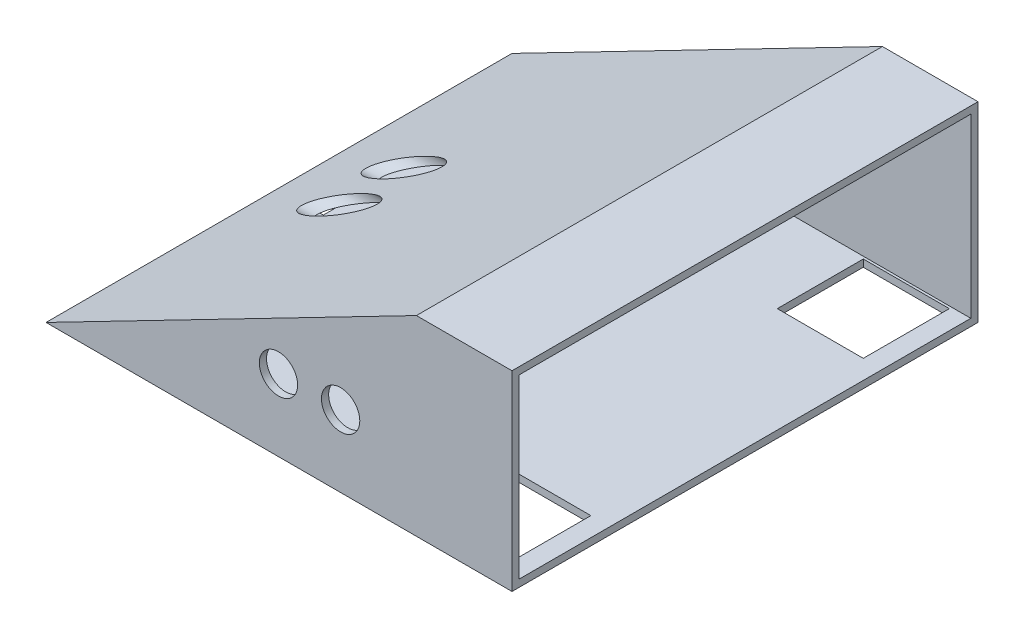
from build123d import *

# Parameters (mm, degrees)
ROBOT_DEPTH                 = 195
VACIO_POR_DENTRO_3MM_T      = -3
SKETCH3_R                   = 8.02
ULTRASONICO_DERECHA_DEPTH   = 3
SKETCH9_R                   = 8.2
ULTRASONICO_IZQUIERDA_DEPTH = 3
SKETCH10_W                  = 37
SKETCH10_H                  = 37
RUEDA_DERECHA_DEPTH         = 3
SKETCH12_W                  = 36
SKETCH12_H                  = 36
RUEDA_IZQUIERDA_DEPTH       = 3
SKETCH14_W                  = 7.1
SKETCH14_H                  = 7.1
CYN70_DERECHA_DEPTH         = 4
SKETCH15_W                  = 7.1
SKETCH15_H                  = 7.1
CNY70_CENTRO_DEPTH          = 4
SKETCH13_W                  = 7.1
SKETCH13_H                  = 7.1
CNY70_IZQUIERDA_DEPTH       = 4
ULTRASONICO_CENTRO_R        = 8.2
CUT_EXTRUDE4_DEPTH          = 75


with BuildPart() as part:
    # Sketch2 → Robot (new body)
    with BuildSketch(Plane.XY):
        Polygon((0, 0), (195, 0), (195, 80), (155, 80), align=None)
    extrude(amount=ROBOT_DEPTH)

    # Vacio por dentro 3mm
    vacio_por_dentro_3mm_openings = [part.faces().sort_by_distance(p)[0] for p in [
        (195, 40, 97.5),
    ]]
    offset(amount=VACIO_POR_DENTRO_3MM_T, openings=vacio_por_dentro_3mm_openings, kind=Kind.INTERSECTION)

    # Sketch3 → Ultrasonico Derecha (cut)
    with BuildSketch(Plane.XY.offset(195)):
        with Locations((97.289863967, 30)):
            Circle(SKETCH3_R)
        with Locations((123.289863967, 30)):
            Circle(SKETCH3_R)
    extrude(amount=-ULTRASONICO_DERECHA_DEPTH, mode=Mode.SUBTRACT)

    # Sketch9 → Ultrasonico Izquierda (cut)
    with BuildSketch(Plane(origin=(0, 0, 0), x_dir=(-1, 0, 0), z_dir=(0, 0, -1))):
        with Locations((-97.284004153, 30)):
            Circle(SKETCH9_R)
        with Locations((-123.284004153, 30)):
            Circle(SKETCH9_R)
    extrude(amount=-ULTRASONICO_IZQUIERDA_DEPTH, mode=Mode.SUBTRACT)

    # Sketch10 → Rueda Derecha (cut)
    with BuildSketch(Plane(origin=(0, 0, 0), x_dir=(-1, 0, 0), z_dir=(0, -1, 0))):
        with Locations((-168.5, -172.5)):
            Rectangle(SKETCH10_W, SKETCH10_H)
    extrude(amount=-RUEDA_DERECHA_DEPTH, mode=Mode.SUBTRACT)

    # Sketch12 → Rueda Izquierda (cut)
    with BuildSketch(Plane(origin=(0, 0, 0), x_dir=(-1, 0, 0), z_dir=(0, -1, 0))):
        with Locations((-169, -22)):
            Rectangle(SKETCH12_W, SKETCH12_H)
    extrude(amount=-RUEDA_IZQUIERDA_DEPTH, mode=Mode.SUBTRACT)

    # Sketch14 → Cyn70 Derecha (cut)
    with BuildSketch(Plane(origin=(0, 0, 0), x_dir=(-1, 0, 0), z_dir=(0, -1, 0))):
        with Locations((-18.55, -183.45)):
            Rectangle(SKETCH14_W, SKETCH14_H)
    extrude(amount=-CYN70_DERECHA_DEPTH, mode=Mode.SUBTRACT)

    # Sketch15 → Cny70 Centro (cut)
    with BuildSketch(Plane(origin=(0, 0, 0), x_dir=(-1, 0, 0), z_dir=(0, -1, 0))):
        with Locations((-18.55, -97.5)):
            Rectangle(SKETCH15_W, SKETCH15_H)
    extrude(amount=-CNY70_CENTRO_DEPTH, mode=Mode.SUBTRACT)

    # Sketch13 → Cny70 Izquierda (cut)
    with BuildSketch(Plane.XZ):
        with Locations((18.55, 11.55)):
            Rectangle(SKETCH13_W, SKETCH13_H)
    extrude(amount=-CNY70_IZQUIERDA_DEPTH, mode=Mode.SUBTRACT)

    # Ultrasonico Centro → Cut-Extrude4 (cut)
    with BuildSketch(Plane(origin=(0, 0, 0), x_dir=(0, 0, -1), z_dir=(1, 0, 0))):
        with Locations((-84, 20)):
            Circle(ULTRASONICO_CENTRO_R)
        with Locations((-111, 20)):
            Circle(ULTRASONICO_CENTRO_R)
    extrude(amount=CUT_EXTRUDE4_DEPTH, mode=Mode.SUBTRACT)


solid = part.part
